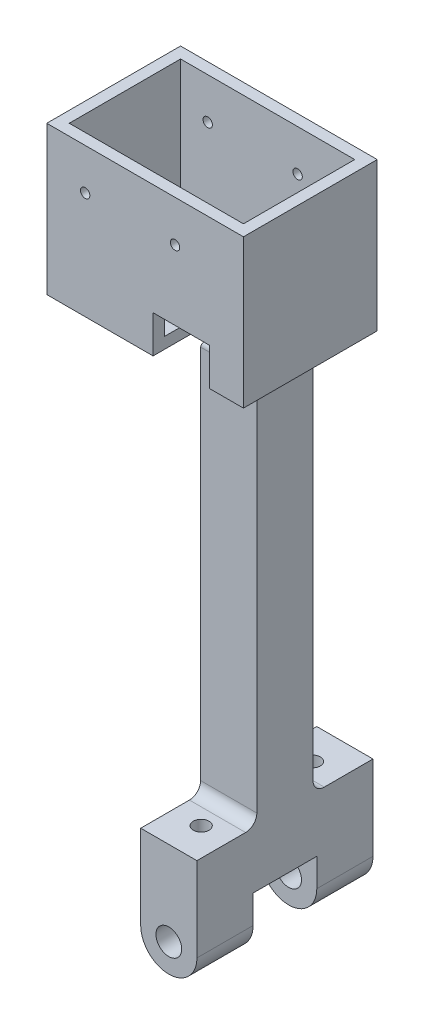
from build123d import *

# Parameters (mm, degrees)
BOSS_EXTRU_1_DEPTH                            = 47
ESQUISSE2_W                                   = 17
ESQUISSE2_H                                   = 14.999999999999986
ENL_V_MAT_EXTRU_1_DEPTH                       = 87.8691544795966
BOSS_EXTRU_2_DEPTH                            = 27.72
BOSS_EXTRU_2_DEPTH_BACK                       = 18.78
BOSS_EXTRU_5_REACH                            = 154.075
BOSS_EXTRU_5_DIRECTION_2_REACH                = 154.075
ESQUISSE5_R                                   = 1.2499999999999978
ENL_V_MAT_EXTRU_2_DEPTH                       = 121.28542019885793
ESQUISSE6_W                                   = 15.000000000000004
ESQUISSE6_H                                   = 11.999999999999996
ENL_V_MAT_EXTRU_3_DEPTH                       = 10
CONG_1_R                                      = 2
CONG_2_R                                      = 3
ESQUISSE9_R                                   = 3.4290000000000016
ENL_V_MAT_EXTRU_4_DEPTH                       = 123.34009215468092
TROU_POUR_TARAUDAGE_POUR_TROU_TARAUD_M5_REACH = 160.94
TROU_POUR_TARAUDAGE_POUR_TROU_TARAUD_2_R      = 2.1
CONG_3_R                                      = 2


with BuildPart() as part:
    # Esquisse1 → Boss.-Extru.1 (new body)
    with BuildSketch(Plane.XY):
        with BuildLine():
            Line((-15, 63.999998751364224), (0, 63.999998751364224))
            Line((0, 63.999998751364224), (-4.3e-16, -63.999998751364224))
            ThreePointArc((-4.3e-16, -63.999998751364224), (-7.499998751364213, -71.5), (-14.999999999999986, -64.00000124863578))
            Line((-14.999999999999986, -64.00000124863578), (-15, 63.999998751364224))
        make_face()
    extrude(amount=BOSS_EXTRU_1_DEPTH)

    # Esquisse2 → Enlèv. mat.-Extru.1 (cut, through all)
    with BuildSketch(Plane.ZY.offset(14.999999999999993)):
        with Locations((23.5, -64.00000000000009)):
            Rectangle(ESQUISSE2_W, ESQUISSE2_H)
        Polygon((47, 63.999998751364224), (31, 63.999998751364224), (31, -41.50000000000009), (47.000000000000014, -41.50000000000009), align=None)
        Polygon((0, 63.999998751364224), (16, 63.999998751364224), (16, -41.5000000000001), (1.292e-14, -41.5000000000001), align=None)
    extrude(amount=-ENL_V_MAT_EXTRU_1_DEPTH, mode=Mode.SUBTRACT)

    # Esquisse3 → Boss.-Extru.2 (add, two sides: drawn at the far end of the back side and taken through both)
    with BuildSketch(Plane.ZY.offset(14.999999999999993).offset(-BOSS_EXTRU_2_DEPTH_BACK)):
        Polygon((38.358000000000004, 103.28494444213939), (38.35800000000001, 66.67694444213939), (8.642, 66.67694444213939), (8.642, 103.28494444213939), (5.641999999999999, 103.28494444213939), (5.642000000000004, 63.676944442139366), (41.35800000000001, 63.676944442139366), (41.358000000000004, 103.28494444213939), align=None)
    extrude(amount=BOSS_EXTRU_2_DEPTH + BOSS_EXTRU_2_DEPTH_BACK)

    # Boss.-Extru.5: up to this face of the body (flat: up to its plane)
    boss_extru_5_end = Plane(part.part.faces().sort_by_distance((-19.47, 103.284944442, 7.142))[0])
    # Esquisse4 → Boss.-Extru.5 (add, up to the picked face)
    with BuildSketch(Plane(origin=(-7.29e-15, 66.67694444213939, 0), x_dir=(1, 1.1e-16, 0), z_dir=(-1.1e-16, 1, 0)), mode=Mode.PRIVATE) as boss_extru_5_sk1:
        Polygon((3.780000000000016, -5.641999999999999), (6.780000000000015, -5.641999999999999), (6.780000000000019, -41.358000000000004), (3.780000000000016, -41.358000000000004), align=None)
    boss_extru_5_tool1 = split(extrude(boss_extru_5_sk1.sketch, amount=BOSS_EXTRU_5_REACH, mode=Mode.PRIVATE), bisect_by=boss_extru_5_end, keep=Keep.BOTH, mode=Mode.PRIVATE)
    # Esquisse4 → Boss.-Extru.5 (add, up to the picked face)
    with BuildSketch(Plane(origin=(-7.29e-15, 66.67694444213939, 0), x_dir=(1, 1.1e-16, 0), z_dir=(-1.1e-16, 1, 0)), mode=Mode.PRIVATE) as boss_extru_5_sk2:
        Polygon((-42.719999999999985, -5.641999999999999), (-45.71999999999999, -5.641999999999999), (-45.719999999999985, -41.358000000000004), (-42.719999999999985, -41.358000000000004), align=None)
    boss_extru_5_tool2 = split(extrude(boss_extru_5_sk2.sketch, amount=BOSS_EXTRU_5_REACH, mode=Mode.PRIVATE), bisect_by=boss_extru_5_end, keep=Keep.BOTH, mode=Mode.PRIVATE)
    add(boss_extru_5_tool1.solids().sort_by(Axis((5.28, 66.676944, 23.5), (-1.1e-16, 1, 0)))[0])
    add(boss_extru_5_tool2.solids().sort_by(Axis((-44.22, 66.676944, 23.5), (-1.1e-16, 1, 0)))[0])

    # Boss.-Extru.5 direction 2: up to this face of the body (flat: up to its plane)
    boss_extru_5_direction_2_end = Plane(part.part.faces().sort_by_distance((-21.345791374, 63.676944442, 23.5))[0])
    # Esquisse4 → Boss.-Extru.5 direction 2 (add, up to the picked face)
    with BuildSketch(Plane(origin=(-7.29e-15, 66.67694444213939, 0), x_dir=(1, 1.1e-16, 0), z_dir=(-1.1e-16, 1, 0)), mode=Mode.PRIVATE) as boss_extru_5_direction_2_sk1:
        Polygon((3.780000000000016, -5.641999999999999), (6.780000000000015, -5.641999999999999), (6.780000000000019, -41.358000000000004), (3.780000000000016, -41.358000000000004), align=None)
    boss_extru_5_direction_2_tool1 = split(extrude(boss_extru_5_direction_2_sk1.sketch, amount=-BOSS_EXTRU_5_DIRECTION_2_REACH, mode=Mode.PRIVATE), bisect_by=boss_extru_5_direction_2_end, keep=Keep.BOTH, mode=Mode.PRIVATE)
    # Esquisse4 → Boss.-Extru.5 direction 2 (add, up to the picked face)
    with BuildSketch(Plane(origin=(-7.29e-15, 66.67694444213939, 0), x_dir=(1, 1.1e-16, 0), z_dir=(-1.1e-16, 1, 0)), mode=Mode.PRIVATE) as boss_extru_5_direction_2_sk2:
        Polygon((-42.719999999999985, -5.641999999999999), (-45.71999999999999, -5.641999999999999), (-45.719999999999985, -41.358000000000004), (-42.719999999999985, -41.358000000000004), align=None)
    boss_extru_5_direction_2_tool2 = split(extrude(boss_extru_5_direction_2_sk2.sketch, amount=-BOSS_EXTRU_5_DIRECTION_2_REACH, mode=Mode.PRIVATE), bisect_by=boss_extru_5_direction_2_end, keep=Keep.BOTH, mode=Mode.PRIVATE)
    add(boss_extru_5_direction_2_tool1.solids().sort_by(Axis((5.28, 66.676944, 23.5), (1.1e-16, -1, 0)))[0])
    add(boss_extru_5_direction_2_tool2.solids().sort_by(Axis((-44.22, 66.676944, 23.5), (1.1e-16, -1, 0)))[0])

    # Esquisse5 → Enlèv. mat.-Extru.2 (cut, through all)
    with BuildSketch(Plane.XY.offset(41.358000000000025)):
        with Locations(Location((-11.469999999999994, 92.28494444213936, 0), (0, 0, 270))):
            Circle(ESQUISSE5_R)
        with Locations(Location((-35.47, 92.28494444213936, 0), (0, 0, 270))):
            Circle(ESQUISSE5_R)
    extrude(amount=-ENL_V_MAT_EXTRU_2_DEPTH, mode=Mode.SUBTRACT)

    # Esquisse6 → Enlèv. mat.-Extru.3 (cut)
    with BuildSketch(Plane.XZ.offset(-63.676944442139366)):
        Polygon((-17.335036050217354, 41.35800000000002), (-2.335036050217353, 41.35800000000002), (-2.3350360502173517, 29.35800000000002), (-17.335036050217354, 29.35800000000002), align=None)
        with Locations((-9.835036050217353, 11.642000000000012)):
            Rectangle(ESQUISSE6_W, ESQUISSE6_H)
    extrude(amount=-ENL_V_MAT_EXTRU_3_DEPTH, mode=Mode.SUBTRACT)

    # Congé1
    cong_1_edges = [part.edges().sort_by_distance(p)[0] for p in [
        (-15, 63.67694444213936, 23.500000000000014),
        (-1.167518025108679, 63.676944442139366, 31),
        (0, 63.676944442139366, 23.5),
        (-1.167518025108679, 63.676944442139366, 16),
    ]]
    fillet(cong_1_edges, radius=CONG_1_R)

    # Congé2
    cong_2_edges = [part.edges().sort_by_distance(p)[0] for p in [
        (-7.499999999999994, -41.50000000000009, 31),
        (-7.499999999999994, -41.5000000000001, 16),
    ]]
    fillet(cong_2_edges, radius=CONG_2_R)

    # Esquisse9 → Enlèv. mat.-Extru.4 (cut, through all)
    with BuildSketch(Plane.XY.offset(47)):
        with Locations((-7.499999999999992, -64)):
            Circle(ESQUISSE9_R)
    extrude(amount=-ENL_V_MAT_EXTRU_4_DEPTH, mode=Mode.SUBTRACT)

    # Trou pour taraudage pour trou taraud 2 → Trou pour taraudage pour trou taraudé M52 (cut, up to next)
    with BuildSketch(Plane(origin=(4.53e-15, -41.5000000000001, 0), x_dir=(1, 1.1e-16, 0), z_dir=(-1.1e-16, 1, 0)), mode=Mode.PRIVATE) as trou_pour_taraudage_pour_trou_taraud_m5_sk1:
        with Locations((-7.5, -8.642)):
            Circle(TROU_POUR_TARAUDAGE_POUR_TROU_TARAUD_2_R)
    trou_pour_taraudage_pour_trou_taraud_m5_tool1 = extrude(trou_pour_taraudage_pour_trou_taraud_m5_sk1.sketch, amount=-TROU_POUR_TARAUDAGE_POUR_TROU_TARAUD_M5_REACH, mode=Mode.PRIVATE) & part.part
    # Trou pour taraudage pour trou taraud 2 → Trou pour taraudage pour trou taraudé M52 (cut, up to next)
    with BuildSketch(Plane(origin=(4.53e-15, -41.5000000000001, 0), x_dir=(1, 1.1e-16, 0), z_dir=(-1.1e-16, 1, 0)), mode=Mode.PRIVATE) as trou_pour_taraudage_pour_trou_taraud_m5_sk2:
        with Locations((-7.5, -38.358)):
            Circle(TROU_POUR_TARAUDAGE_POUR_TROU_TARAUD_2_R)
    trou_pour_taraudage_pour_trou_taraud_m5_tool2 = extrude(trou_pour_taraudage_pour_trou_taraud_m5_sk2.sketch, amount=-TROU_POUR_TARAUDAGE_POUR_TROU_TARAUD_M5_REACH, mode=Mode.PRIVATE) & part.part
    add(trou_pour_taraudage_pour_trou_taraud_m5_tool1.solids().sort_by_distance((-7.5, -41.5, 8.642))[0], mode=Mode.SUBTRACT)
    add(trou_pour_taraudage_pour_trou_taraud_m5_tool2.solids().sort_by_distance((-7.5, -41.5, 38.358))[0], mode=Mode.SUBTRACT)

    # Congé3
    # the kernel refuses this fillet: 2 mm, written as the material it takes off along each edge
    with BuildSketch(Plane(origin=(-19.919245368957963, 63.676944442139366, 16), x_dir=(1.1e-16, -1, 0), z_dir=(1, 1.1e-16, 0))) as cong_3_piece_1:
        with BuildLine():
            CenterArc((1.9676981475831852, -2), CONG_3_R, 90, 79.68848194075031)
            Line((5.6133e-13, -1.6420000000001131), (0, 0))
            Line((0, 0), (1.9676981475831852, 0))
        make_face()
    extrude(amount=17.584209318740605, mode=Mode.SUBTRACT)
    with BuildSketch(Plane(origin=(-15, 63.67694444213936, 17.64200000000001), x_dir=(0, -1, 0), z_dir=(0, 0, -1))) as cong_3_piece_2:
        with BuildLine():
            CenterArc((CONG_3_R, -CONG_3_R), CONG_3_R, 90, 90)
            Line((0, -CONG_3_R), (0, 0))
            Line((0, 0), (CONG_3_R, 0))
        make_face()
    extrude(amount=6.64200000000001, mode=Mode.SUBTRACT)
    with BuildSketch(Plane(origin=(-19.919245368957963, 63.676944442139366, 31), x_dir=(1.1e-16, -1, 0), z_dir=(1, 1.1e-16, 0))) as cong_3_piece_3:
        with BuildLine():
            CenterArc((1.967698147583178, 2), CONG_3_R, 190.31151805925052, 79.68848194074951)
            Line((5.6133e-13, 1.6420000000000847), (0, 0))
            Line((0, 0), (1.967698147583178, 0))
        make_face()
    extrude(amount=17.584209318740605, mode=Mode.SUBTRACT)
    with BuildSketch(Plane(origin=(-15, 63.67694444213936, 36.00000000000001), x_dir=(0, -1, 0), z_dir=(0, 0, -1))) as cong_3_piece_4:
        with BuildLine():
            CenterArc((CONG_3_R, -CONG_3_R), CONG_3_R, 90, 90)
            Line((0, -CONG_3_R), (0, 0))
            Line((0, 0), (CONG_3_R, 0))
        make_face()
    extrude(amount=6.641999999999989, mode=Mode.SUBTRACT)


solid = part.part
